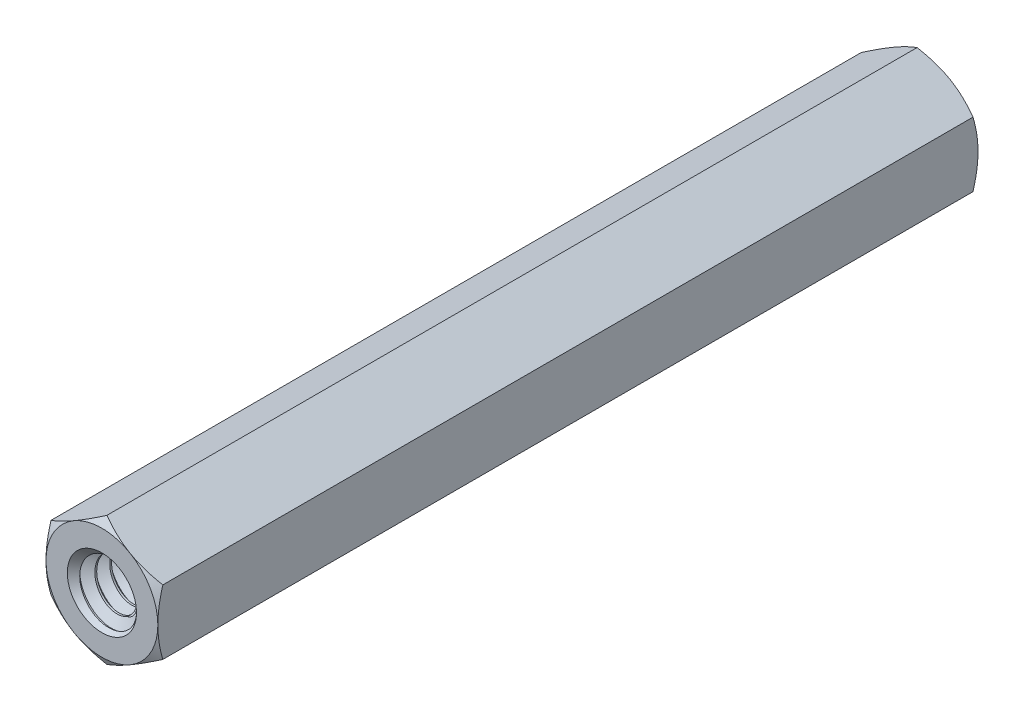
from build123d import *

# Parameters (mm, degrees)
EXTRUDE1_DEPTH          = 17.4625
EXTRUDE1_DEPTH_BACK     = 17.4625
SKETCH1_R               = 1.4224
SWEEP1_PITCH            = 0.635
EXTRUDE2_DEPTH          = 36.745723476
SKETCH8_OUTSIDE_W       = 141.312
SKETCH8_OUTSIDE_H       = 142.05
SKETCH8_OUTSIDE_R       = 2.38125
EXTRUDE4_DEPTH          = 36.745723476
EXTRUDE4_DRAFT          = -60
MIRROR1_COPY_1_SKETCH_W = 141.312
MIRROR1_COPY_1_SKETCH_H = 142.05
MIRROR1_COPY_1_SKETCH_R = 2.38125
MIRROR1_COPY_1_DEPTH    = 36.745723476
MIRROR1_COPY_1_DRAFT    = -60
SKETCH9_W               = 22.225
SKETCH9_H               = 1.4732


with BuildPart() as part:
    # Sketch1 → Extrude1 (new, two sides: drawn at the far end of the back side and taken through both)
    with BuildSketch(Plane.XY.offset(-EXTRUDE1_DEPTH_BACK)):
        Polygon((0, 2.749630657), (-2.38125, 1.374815329), (-2.38125, -1.374815329), (0, -2.749630657), (2.38125, -1.374815329), (2.38125, 1.374815329), align=None)
        Circle(SKETCH1_R, mode=Mode.SUBTRACT)
    extrude(amount=EXTRUDE1_DEPTH + EXTRUDE1_DEPTH_BACK)

    # Sweep1: the profile of Sketch12 profile screwed along a right-hand helix of 56 turns, 6 arcs to a turn; built about Z, then put on its axis
    sweep1_z = Axis((0, 0, 0), (0, 0, 1))
    sweep1_corners = [(1.4227, 0, -0.555798205), (1.4227, 0, 0.000173205), (1.009955401, 0, -0.238125), (1.009955401, 0, -0.3175)]
    with BuildLine(mode=Mode.PRIVATE) as sweep1_profile:
        Line(sweep1_corners[0], sweep1_corners[1])
        Line(sweep1_corners[1], sweep1_corners[2])
        Line(sweep1_corners[2], sweep1_corners[3])
        Line(sweep1_corners[3], sweep1_corners[0])
    sweep1_cap = Face(sweep1_profile.wire())
    sweep1_turn_angles = [0, 30, 60, 90, 120, 150, 180, 210, 240, 270, 300, 330, 360, 390, 420, 450, 480, 510, 540, 570, 600, 630, 660, 690, 720]
    sweep1_turn_weights = [1, 0.8660254037844387, 1, 0.8660254037844387, 1, 0.8660254037844387, 1, 0.8660254037844387, 1, 0.8660254037844387, 1, 0.8660254037844387, 1, 0.8660254037844387, 1, 0.8660254037844387, 1, 0.8660254037844387, 1, 0.8660254037844387, 1, 0.8660254037844387, 1, 0.8660254037844387, 1]
    sweep1_turn_rails = [Edge.make_bspline([Vector(p[0], p[1], 0).rotate(sweep1_z, sweep1_turn_angles[k]) / sweep1_turn_weights[k] + Vector(0, 0, p[2] + SWEEP1_PITCH * sweep1_turn_angles[k] / 360) for k in range(25)], [0, 0, 0, 1, 1, 2, 2, 3, 3, 4, 4, 5, 5, 6, 6, 7, 7, 8, 8, 9, 9, 10, 10, 11, 11, 12, 12, 12], 2, sweep1_turn_weights) for p in sweep1_corners]
    sweep1_turn_sides = [Face.make_surface_from_curves(sweep1_turn_rails[p[0]], sweep1_turn_rails[p[1]]) for p in [(0, 1), (1, 2), (2, 3), (3, 0)]]
    sweep1 = Plane(origin=(0, 0, -17.4625), x_dir=(0, 1, 0), z_dir=(0, 0, 1)) * Solid(Shell([*[p.moved(Location((0, 0, 2 * SWEEP1_PITCH * i))) for i in range(28) for p in sweep1_turn_sides], sweep1_cap, sweep1_cap.rotate(sweep1_z, 20160).moved(Location((0, 0, SWEEP1_PITCH * 20160 / 360)))]))
    add(sweep1)

    # Sketch6 → Extrude2 (cut, through all)
    with BuildSketch(Plane(origin=(0, 0, -17.4625), x_dir=(-1, 0, 0), z_dir=(0, 0, -1))):
        Polygon((0, 2.749630657), (-2.38125, 1.374815329), (-2.38125, -1.374815329), (0, -2.749630657), (2.38125, -1.374815329), (2.38125, 1.374815329), align=None)
    extrude2 = extrude(amount=EXTRUDE2_DEPTH, mode=Mode.SUBTRACT)

    # Extrude3 cone 1 section (through the dimple's axis) → Extrude3 (revolve, cut)
    with BuildSketch(Plane(origin=(0, 0, -17.4625), x_dir=(0, 1, 0), z_dir=(1, 0, 0))):
        Polygon((0, 0), (1.4732, 0), (0, 1.579813584), align=None)
    extrude3 = revolve(axis=Axis((0, 0, -17.4625), (0, 0, 1)), mode=Mode.SUBTRACT)


with BuildPart() as extrude4_tool:
    # Sketch8 outside → Extrude4 (with draft: the straight prism first)
    with BuildSketch(Plane(origin=(0, 0, -17.4625), x_dir=(-1, 0, 0), z_dir=(0, 0, -1))):
        Rectangle(SKETCH8_OUTSIDE_W, SKETCH8_OUTSIDE_H)
        Circle(SKETCH8_OUTSIDE_R, mode=Mode.SUBTRACT)
    extrude(amount=-EXTRUDE4_DEPTH)
    # Extrude4: the draft: its side faces are tilted about the plane it starts from
    extrude4_sides = [extrude4_tool.faces().sort_by_distance(p)[0] for p in [
        (0, -71.025, 0.910361738),
        (-70.656, 0, 0.910361738),
        (0, 71.025, 0.910361738),
        (70.656, 0, 0.910361738),
        (2.38125, 0, 0.910361738),
    ]]
    draft(extrude4_sides, Plane(origin=(0, 0, -17.4625), x_dir=(-1, 0, 0), z_dir=(0, 0, -1)), EXTRUDE4_DRAFT)


with BuildPart() as part_1:
    add(part.part)

    # Extrude4: cut by extrude4_tool
    add(extrude4_tool.part, mode=Mode.SUBTRACT)

    # Mirror1: Extrude2, Extrude3 across plane
    add(extrude2.mirror(Plane.XY), mode=Mode.SUBTRACT)
    add(extrude3.mirror(Plane.XY), mode=Mode.SUBTRACT)


with BuildPart() as mirror1_copy_1_tool:
    # Mirror1 copy 1 sketch → Mirror1 copy 1 (with draft: the straight prism first)
    with BuildSketch(Plane(origin=(0, 0, 17.4625), x_dir=(-1, 0, 0), z_dir=(0, 0, 1))):
        Rectangle(MIRROR1_COPY_1_SKETCH_W, MIRROR1_COPY_1_SKETCH_H)
        Circle(MIRROR1_COPY_1_SKETCH_R, mode=Mode.SUBTRACT)
    extrude(amount=-MIRROR1_COPY_1_DEPTH)
    # Mirror1 copy 1: the draft: its side faces are tilted about the plane it starts from
    mirror1_copy_1_sides = [mirror1_copy_1_tool.faces().sort_by_distance(p)[0] for p in [
        (0, -71.025, -0.910361738),
        (-70.656, 0, -0.910361738),
        (0, 71.025, -0.910361738),
        (70.656, 0, -0.910361738),
        (2.38125, 0, -0.910361738),
    ]]
    draft(mirror1_copy_1_sides, Plane(origin=(0, 0, 17.4625), x_dir=(-1, 0, 0), z_dir=(0, 0, 1)), MIRROR1_COPY_1_DRAFT)


with BuildPart() as part_2:
    add(part_1.part)

    # Mirror1 copy 1: cut by mirror1_copy_1_tool
    add(mirror1_copy_1_tool.part, mode=Mode.SUBTRACT)

    # Sketch9 → Revolve 2 (revolve)
    with BuildSketch(Plane(origin=(0, 0, 0), x_dir=(0, 0, -1), z_dir=(1, 0, 0)), mode=Mode.PRIVATE) as revolve_2_sk:
        with Locations((0, 0.7366)):
            Rectangle(SKETCH9_W, SKETCH9_H)
    revolve(revolve_2_sk.sketch.rotate(Axis((0, 0, 17.4625), (0, 0, -1)), 270), axis=Axis((0, 0, 17.4625), (0, 0, -1)))


solid = part_2.part
